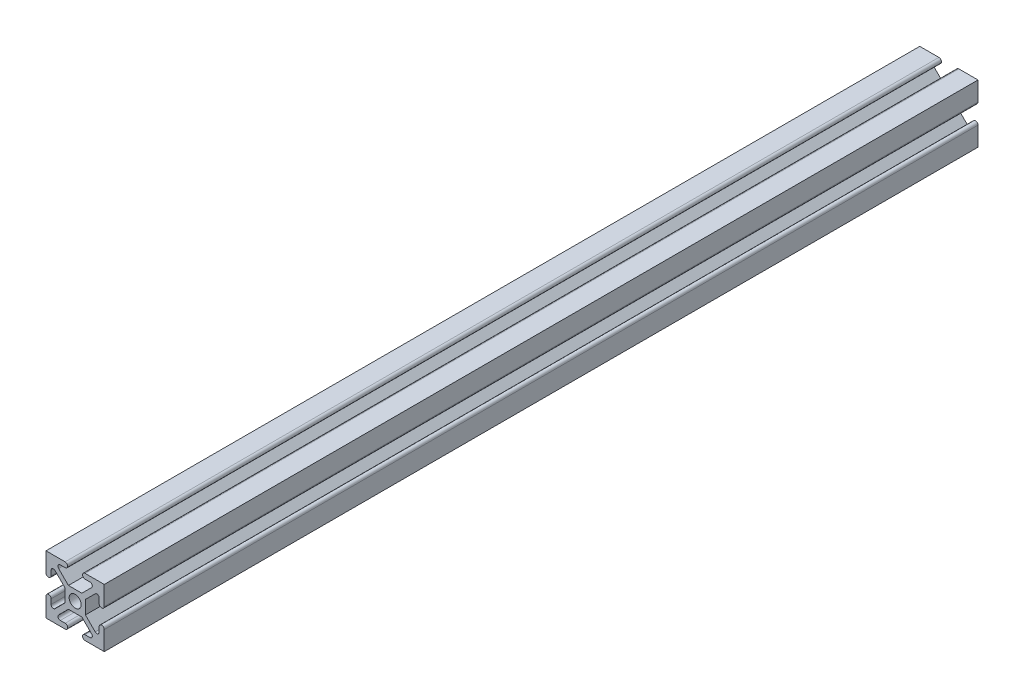
from build123d import *

# Parameters (mm, degrees)
SKETCH1_R           = 2.6035
BOSS_EXTRUDE1_DEPTH = 381


with BuildPart() as part:
    # Sketch1 → Boss-Extrude1 (new body)
    with BuildSketch(Plane.XY):
        with BuildLine():
            Line((-12.7, -12.7), (-4.343399971, -12.7))
            ThreePointArc((-4.343399971, -12.7), (-3.238499971, -11.5951), (-4.343399971, -10.4902))
            Line((-4.343399971, -10.4902), (-6.474794456, -10.4902))
            ThreePointArc((-6.474794456, -10.4902), (-7.413456061, -9.863006367), (-7.193214945, -8.75577951))
            Line((-7.193214945, -8.75577951), (-2.933235435, -4.4958))
            Line((-2.933235435, -4.4958), (2.933235435, -4.4958))
            Line((2.933235435, -4.4958), (7.193214945, -8.75577951))
            ThreePointArc((7.193214945, -8.75577951), (7.413456061, -9.863006367), (6.474794456, -10.4902))
            Line((6.474794456, -10.4902), (4.3434, -10.4902))
            ThreePointArc((4.3434, -10.4902), (3.2385, -11.5951), (4.3434, -12.7))
            Line((4.3434, -12.7), (12.7, -12.7))
            Line((12.7, -12.7), (12.7, -4.343399971))
            ThreePointArc((12.7, -4.343399971), (11.5951, -3.238499971), (10.4902, -4.343399971))
            Line((10.4902, -4.343399971), (10.4902, -6.474794456))
            ThreePointArc((10.4902, -6.474794456), (9.863006367, -7.413456061), (8.75577951, -7.193214945))
            Line((8.75577951, -7.193214945), (4.4958, -2.933235435))
            Line((4.4958, -2.933235435), (4.4958, 2.933235435))
            Line((4.4958, 2.933235435), (8.75577951, 7.193214945))
            ThreePointArc((8.75577951, 7.193214945), (9.863006367, 7.413456061), (10.4902, 6.474794456))
            Line((10.4902, 6.474794456), (10.4902, 4.3434))
            ThreePointArc((10.4902, 4.3434), (11.5951, 3.2385), (12.7, 4.3434))
            Line((12.7, 4.3434), (12.7, 12.7))
            Line((12.7, 12.7), (4.343399971, 12.7))
            ThreePointArc((4.343399971, 12.7), (3.238499971, 11.5951), (4.343399971, 10.4902))
            Line((4.343399971, 10.4902), (6.474794456, 10.4902))
            ThreePointArc((6.474794456, 10.4902), (7.413456061, 9.863006367), (7.193214945, 8.75577951))
            Line((7.193214945, 8.75577951), (2.933235435, 4.4958))
            Line((2.933235435, 4.4958), (-2.933235435, 4.4958))
            Line((-2.933235435, 4.4958), (-7.193214945, 8.75577951))
            ThreePointArc((-7.193214945, 8.75577951), (-7.413456061, 9.863006367), (-6.474794456, 10.4902))
            Line((-6.474794456, 10.4902), (-4.3434, 10.4902))
            ThreePointArc((-4.3434, 10.4902), (-3.2385, 11.5951), (-4.3434, 12.7))
            Line((-4.3434, 12.7), (-12.7, 12.7))
            Line((-12.7, 12.7), (-12.7, 4.343399971))
            ThreePointArc((-12.7, 4.343399971), (-11.5951, 3.238499971), (-10.4902, 4.343399971))
            Line((-10.4902, 4.343399971), (-10.4902, 6.474794456))
            ThreePointArc((-10.4902, 6.474794456), (-9.863006367, 7.413456061), (-8.75577951, 7.193214945))
            Line((-8.75577951, 7.193214945), (-4.4958, 2.933235435))
            Line((-4.4958, 2.933235435), (-4.4958, -2.933235435))
            Line((-4.4958, -2.933235435), (-8.75577951, -7.193214945))
            ThreePointArc((-8.75577951, -7.193214945), (-9.863006367, -7.413456061), (-10.4902, -6.474794456))
            Line((-10.4902, -6.474794456), (-10.4902, -4.3434))
            ThreePointArc((-10.4902, -4.3434), (-11.5951, -3.2385), (-12.7, -4.3434))
            Line((-12.7, -4.3434), (-12.7, -12.7))
        make_face()
        Circle(SKETCH1_R, mode=Mode.SUBTRACT)
    extrude(amount=-BOSS_EXTRUDE1_DEPTH)


solid = part.part
